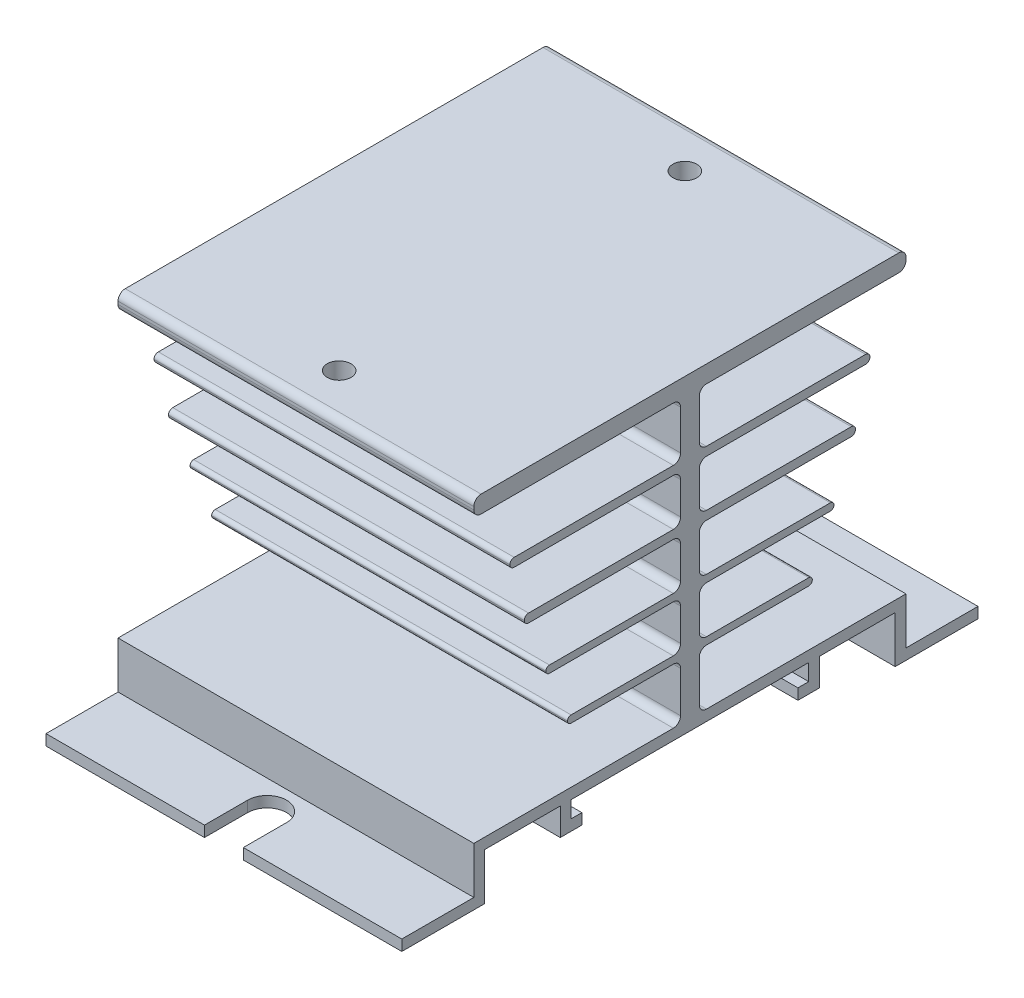
from build123d import *

# Parameters (mm, degrees)
BASE_DEPTH                 = 24.7
DINRAILLEG_START           = -24.7
DINRAILLEG_DEPTH           = 49.4
MAINRIB_START              = -24.7
MAINRIBS_W                 = 2.6
MAINRIBS_H                 = 41.5
MAINRIB_DEPTH              = 49.4
TOPBASE_START              = -24.7
TOPBASES_W                 = 60
TOPBASES_H                 = 2.4
TOPBASE_DEPTH              = 49.4
RIB1_START                 = -24.7
RIB1S_W                    = 50
RIB1S_H                    = 1.2
RIB1_DEPTH                 = 49.4
RIB2_START                 = -24.7
RIB2S_W                    = 46
RIB2S_H                    = 1.2
RIB2_DEPTH                 = 49.4
RIB3_START                 = -24.7
RIB3S_W                    = 40
RIB3S_H                    = 1
RIB3_DEPTH                 = 49.4
RIB4_START                 = -24.7
RIB4S_W                    = 34
RIB4S_H                    = 1
RIB4_DEPTH                 = 49.4
MOUNTINGSLOT_DEPTH         = 68.186977905
M4X0_7_TAPPED_HOLE1_REACH  = 70.267
M4X0_7_TAPPED_HOLE1_BORE_R = 1.65
TBF_R                      = 1
MRF_R                      = 1
FILLET_F1_R                = 0.6
FILLET_F2_R                = 0.6
FILLET_F3_R                = 0.5
FILLET_F4_R                = 0.5


with BuildPart() as part:
    # BaseS → Base (new, symmetric)
    with BuildSketch(Plane(origin=(0, 0, 0), x_dir=(0, 0, -1), z_dir=(1, 0, 0))):
        Polygon((40, -6.5), (30, -6.5), (30, 0), (-30, 0), (-30, -6.5), (-40, -6.5), (-40, -8), (-28.5, -8), (-28.5, -1.5), (28.5, -1.5), (28.5, -8), (40, -8), align=None)
    extrude(amount=BASE_DEPTH, both=True)

    # DinRailLegS → DinRailLeg (add)
    with BuildSketch(Plane(origin=(0, 0, 0), x_dir=(0, 0, -1), z_dir=(1, 0, 0)).offset(DINRAILLEG_START)):
        Polygon((18, -1.5), (18, -5.3), (15, -5.3), (15, -3.8), (16.5, -3.8), (16.5, -1.5), align=None)
    dinrailleg = extrude(amount=DINRAILLEG_DEPTH)

    # MainRibS → MainRib (add)
    with BuildSketch(Plane(origin=(0, 0, 0), x_dir=(0, 0, -1), z_dir=(1, 0, 0)).offset(MAINRIB_START)):
        with Locations((0, 20.75)):
            Rectangle(MAINRIBS_W, MAINRIBS_H)
    extrude(amount=MAINRIB_DEPTH)

    # TopBaseS → TopBase (add)
    with BuildSketch(Plane(origin=(0, 0, 0), x_dir=(0, 0, -1), z_dir=(1, 0, 0)).offset(TOPBASE_START)):
        with Locations((0, 40.3)):
            Rectangle(TOPBASES_W, TOPBASES_H)
    extrude(amount=TOPBASE_DEPTH)

    # Rib1S → Rib1 (add)
    with BuildSketch(Plane(origin=(0, 0, 0), x_dir=(0, 0, -1), z_dir=(1, 0, 0)).offset(RIB1_START)):
        with Locations((0, 31)):
            Rectangle(RIB1S_W, RIB1S_H)
    extrude(amount=RIB1_DEPTH)

    # Rib2S → Rib2 (add)
    with BuildSketch(Plane(origin=(0, 0, 0), x_dir=(0, 0, -1), z_dir=(1, 0, 0)).offset(RIB2_START)):
        with Locations((0, 23.3)):
            Rectangle(RIB2S_W, RIB2S_H)
    extrude(amount=RIB2_DEPTH)

    # Rib3S → Rib3 (add)
    with BuildSketch(Plane(origin=(0, 0, 0), x_dir=(0, 0, -1), z_dir=(1, 0, 0)).offset(RIB3_START)):
        with Locations((0, 15.7)):
            Rectangle(RIB3S_W, RIB3S_H)
    extrude(amount=RIB3_DEPTH)

    # Rib4S → Rib4 (add)
    with BuildSketch(Plane(origin=(0, 0, 0), x_dir=(0, 0, -1), z_dir=(1, 0, 0)).offset(RIB4_START)):
        with Locations((0, 8.2)):
            Rectangle(RIB4S_W, RIB4S_H)
    extrude(amount=RIB4_DEPTH)

    # MountingSlotS → MountingSlot (cut, through all)
    with BuildSketch(Plane(origin=(0, -6.5, 0), x_dir=(1, 0, 0), z_dir=(0, 1, 0))):
        with BuildLine():
            Line((2.7, 40), (2.7, 34))
            ThreePointArc((2.7, 34), (0, 31.3), (-2.7, 34))
            Line((-2.7, 34), (-2.7, 40))
            ThreePointArc((-2.7, 40), (0, 42.7), (2.7, 40))
        make_face()
    mountingslot = extrude(amount=-MOUNTINGSLOT_DEPTH, mode=Mode.SUBTRACT)

    # M4x0.7 Tapped Hole1 bore → M4x0.7 Tapped Hole1 (cut, up to next)
    with BuildSketch(Plane(origin=(0, 41.5, 0), x_dir=(1, 0, 0), z_dir=(0, 1, 0)), mode=Mode.PRIVATE) as m4x0_7_tapped_hole1_sk1:
        with Locations((0, 24)):
            Circle(M4X0_7_TAPPED_HOLE1_BORE_R)
    m4x0_7_tapped_hole1_tool1 = extrude(m4x0_7_tapped_hole1_sk1.sketch, amount=-M4X0_7_TAPPED_HOLE1_REACH, mode=Mode.PRIVATE) & part.part
    m4x0_7_tapped_hole1 = m4x0_7_tapped_hole1_tool1.solids().sort_by_distance((0, 41.5, -24))[0]
    add(m4x0_7_tapped_hole1, mode=Mode.SUBTRACT)

    # Mounting Features VM: DinRailLeg, MountingSlot, M4x0.7 Tapped Hole1 across plane
    add(dinrailleg.mirror(Plane.XY))
    add(mountingslot.mirror(Plane.XY), mode=Mode.SUBTRACT)
    add(m4x0_7_tapped_hole1.mirror(Plane.XY), mode=Mode.SUBTRACT)

    # TBF
    tbf_edges = [part.edges().sort_by_distance(p)[0] for p in [
        (0, 41.5, -30),
        (0, 39.1, 30),
        (0, 39.1, -30),
        (0, 41.5, 30),
    ]]
    fillet(tbf_edges, radius=TBF_R)

    # MRF
    mrf_edges = [part.edges().sort_by_distance(p)[0] for p in [
        (0, 23.9, -1.3),
        (0, 22.7, -1.3),
        (0, 22.7, 1.3),
        (0, 23.9, 1.3),
        (0, 15.2, -1.3),
        (0, 15.2, 1.3),
        (0, 16.2, -1.3),
        (0, 16.2, 1.3),
        (0, 7.7, -1.3),
        (0, 7.7, 1.3),
        (0, 8.7, -1.3),
        (0, 8.7, 1.3),
        (0, 0, -1.3),
        (0, 0, 1.3),
        (0, 39.1, 1.3),
        (0, 39.1, -1.3),
        (0, 31.6, -1.3),
        (0, 31.6, 1.3),
        (0, 30.4, -1.3),
        (0, 30.4, 1.3),
    ]]
    fillet(mrf_edges, radius=MRF_R)

    # Fillet F1
    fillet_f1_edges = [part.edges().sort_by_distance(p)[0] for p in [
        (0, 30.4, -25),
        (0, 31.6, -25),
        (0, 30.4, 25),
        (0, 31.6, 25),
    ]]
    fillet(fillet_f1_edges, radius=FILLET_F1_R - 0.0001)  # a hair under: the kernel refuses the full size

    # Fillet F2
    fillet_f2_edges = [part.edges().sort_by_distance(p)[0] for p in [
        (0, 23.9, -23),
        (0, 22.7, -23),
        (0, 23.9, 23),
        (0, 22.7, 23),
    ]]
    fillet(fillet_f2_edges, radius=FILLET_F2_R - 0.0001)  # a hair under: the kernel refuses the full size

    # Fillet F3
    fillet_f3_edges = [part.edges().sort_by_distance(p)[0] for p in [
        (0, 15.2, -20),
        (0, 16.2, -20),
        (0, 15.2, 20),
        (0, 16.2, 20),
    ]]
    fillet(fillet_f3_edges, radius=FILLET_F3_R - 0.0001)  # a hair under: the kernel refuses the full size

    # Fillet F4
    fillet_f4_edges = [part.edges().sort_by_distance(p)[0] for p in [
        (0, 8.7, 17),
        (0, 7.7, 17),
        (0, 7.7, -17),
        (0, 8.7, -17),
    ]]
    fillet(fillet_f4_edges, radius=FILLET_F4_R - 0.0001)  # a hair under: the kernel refuses the full size


solid = part.part
